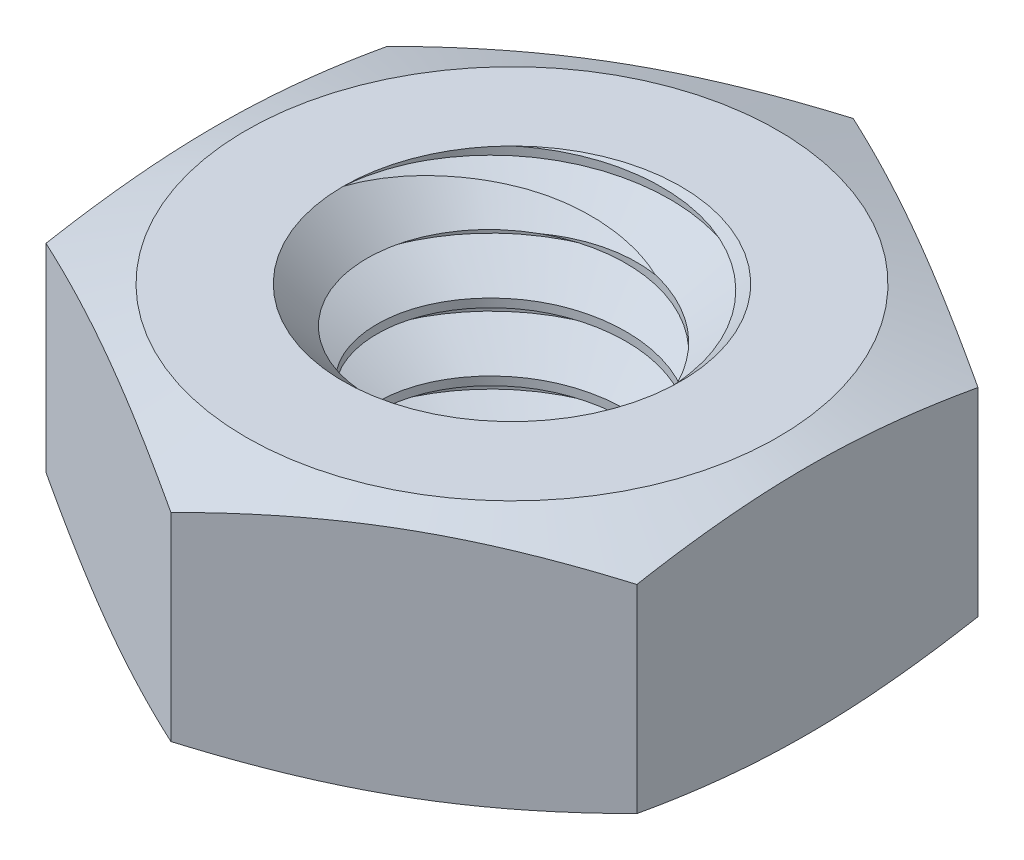
from build123d import *

# Parameters (mm, degrees)
BOSS_EXTRUDE3_DEPTH      = 2.38125
BOSS_EXTRUDE3_DEPTH_BACK = 2.38125
SKETCH8_R                = 3.175
SWEEP1_PITCH             = 1.27
CUT_EXTRUDE2_DEPTH       = 10.75169072
CUT_EXTRUDE2_DEPTH_BACK  = 10.75169072
SKETCH12_W               = 10.00125
SKETCH12_H               = 254


# Read off the part's stored shape, not the designer's step: Cut-Extrude1
with BuildPart() as part:
    # Sketch8 → Boss-Extrude3 (new, two sides: drawn at the far end of the back side and taken through both)
    with BuildSketch(Plane(origin=(0, 0, 0), x_dir=(1, 0, 0), z_dir=(0, 1, 0)).offset(-BOSS_EXTRUDE3_DEPTH_BACK)):
        Polygon((0, -6.415804866), (5.55625, -3.207902433), (5.55625, 3.207902433), (0, 6.415804866), (-5.55625, 3.207902433), (-5.55625, -3.207902433), align=None)
        with Locations(Location((0, 0, 0), (0, 0, 270))):
            Circle(SKETCH8_R, mode=Mode.SUBTRACT)
    extrude(amount=BOSS_EXTRUDE3_DEPTH + BOSS_EXTRUDE3_DEPTH_BACK)

    # Sketch10 → Cut-Revolve1 (revolve, cut)
    with BuildSketch(Plane(origin=(0, 0, 0), x_dir=(0, 0, -1), z_dir=(1, 0, 0))):
        Polygon((-6.415804866, 1.866166653), (-5.000625, 2.38125), (-6.415804866, 2.38125), align=None)
        Polygon((-6.415804866, -1.866166653), (-6.415804866, -2.38125), (-5.000625, -2.38125), align=None)
    revolve(axis=Axis((0, 2.38125, 0), (0, -1, 0)), mode=Mode.SUBTRACT)

    # Sweep1: the profile of Sketch11 screwed along a right-hand helix of 5.625 turns, 8 arcs to a turn; built about Z, then put on its axis
    sweep1_z = Axis((0, 0, 0), (0, 0, 1))
    sweep1_corners = [(2.350110803, 0, -0.47625), (2.350110803, 0, -0.635), (3.243740766, 0, -1.1509375), (3.243740766, 0, 0.0396875)]
    with BuildLine(mode=Mode.PRIVATE) as sweep1_profile:
        Line(sweep1_corners[0], sweep1_corners[1])
        Line(sweep1_corners[1], sweep1_corners[2])
        Line(sweep1_corners[2], sweep1_corners[3])
        Line(sweep1_corners[3], sweep1_corners[0])
    sweep1_cap = Face(sweep1_profile.wire())
    sweep1_turn_angles = [0, 22.5, 45, 67.5, 90, 112.5, 135, 157.5, 180, 202.5, 225, 247.5, 270, 292.5, 315, 337.5, 360]
    sweep1_turn_weights = [1, 0.9238795325112867, 1, 0.9238795325112867, 1, 0.9238795325112867, 1, 0.9238795325112867, 1, 0.9238795325112867, 1, 0.9238795325112867, 1, 0.9238795325112867, 1, 0.9238795325112867, 1]
    sweep1_turn_rails = [Edge.make_bspline([Vector(p[0], p[1], 0).rotate(sweep1_z, sweep1_turn_angles[k]) / sweep1_turn_weights[k] + Vector(0, 0, p[2] + SWEEP1_PITCH * sweep1_turn_angles[k] / 360) for k in range(17)], [0, 0, 0, 1, 1, 2, 2, 3, 3, 4, 4, 5, 5, 6, 6, 7, 7, 8, 8, 8], 2, sweep1_turn_weights) for p in sweep1_corners]
    sweep1_turn_sides = [Face.make_surface_from_curves(sweep1_turn_rails[p[0]], sweep1_turn_rails[p[1]]) for p in [(0, 1), (1, 2), (2, 3), (3, 0)]]
    sweep1_last_angles = [1800, 1822.5, 1845, 1867.5, 1890, 1912.5, 1935, 1957.5, 1980, 2002.5, 2025]
    sweep1_last_weights = [1, 0.9238795325112867, 1, 0.9238795325112867, 1, 0.9238795325112867, 1, 0.9238795325112867, 1, 0.9238795325112739, 1]
    sweep1_last_rails = [Edge.make_bspline([Vector(p[0], p[1], 0).rotate(sweep1_z, sweep1_last_angles[k]) / sweep1_last_weights[k] + Vector(0, 0, p[2] + SWEEP1_PITCH * sweep1_last_angles[k] / 360) for k in range(11)], [0, 0, 0, 1, 1, 2, 2, 3, 3, 4, 4, 5, 5, 5], 2, sweep1_last_weights) for p in sweep1_corners]
    sweep1_last_sides = [Face.make_surface_from_curves(sweep1_last_rails[p[0]], sweep1_last_rails[p[1]]) for p in [(0, 1), (1, 2), (2, 3), (3, 0)]]
    sweep1 = Plane(origin=(0, -2.38125, 0), x_dir=(0, 0, 1), z_dir=(0, 1, 0)) * Solid(Shell([*[p.moved(Location((0, 0, SWEEP1_PITCH * i))) for i in range(5) for p in sweep1_turn_sides], *sweep1_last_sides, sweep1_cap, sweep1_cap.rotate(sweep1_z, 2025).moved(Location((0, 0, SWEEP1_PITCH * 2025 / 360)))]))
    add(sweep1)

    # Sketch12 → Cut-Extrude2 (cut, two sides: drawn at the far end of the back side and taken through both)
    with BuildSketch(Plane(origin=(0, 0, 0), x_dir=(0, 0, -1), z_dir=(1, 0, 0)).offset(-CUT_EXTRUDE2_DEPTH_BACK)):
        with Locations((0, 129.38125)):
            Rectangle(SKETCH12_W, SKETCH12_H)
        with Locations((0, -129.38125)):
            Rectangle(SKETCH12_W, SKETCH12_H)
    extrude(amount=CUT_EXTRUDE2_DEPTH + CUT_EXTRUDE2_DEPTH_BACK, mode=Mode.SUBTRACT)

    # Cut-Extrude1 outline → Cut-Extrude1 (revolve, cut)
    with BuildSketch(Plane.XY):
        Polygon((3.175, -2.38125), (2.350104501, -1.556354501), (2.350104501, -2.38125), align=None)
    cut_extrude1 = revolve(axis=Axis((0, 0, 0), (0, 1, 0)), mode=Mode.SUBTRACT)

    # Mirror1: Cut-Extrude1 across plane
    add(cut_extrude1.mirror(Plane.ZX), mode=Mode.SUBTRACT)


solid = part.part
